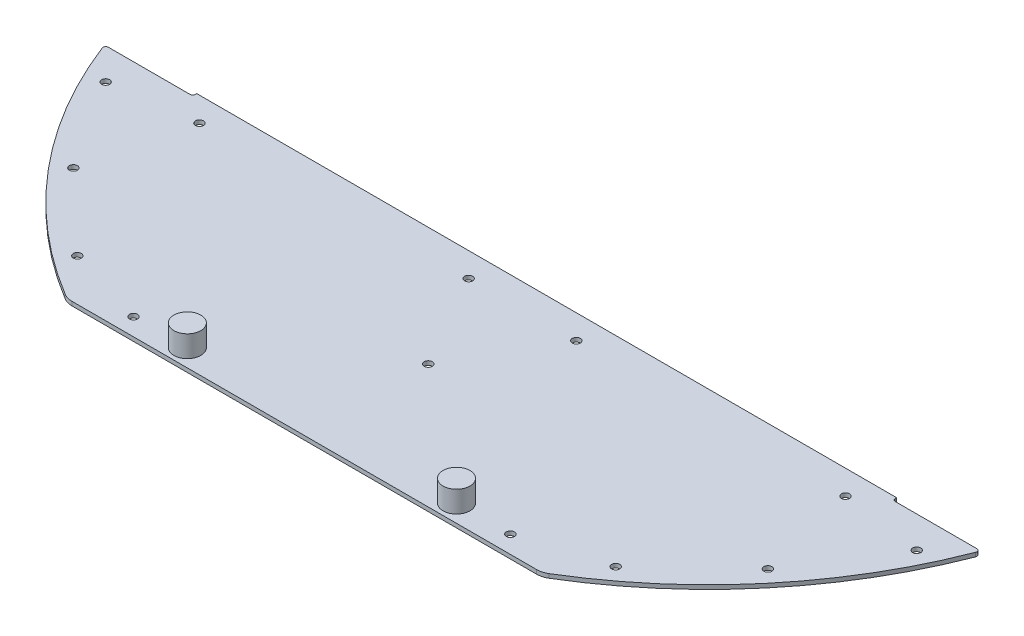
from build123d import *

# Parameters (mm, degrees)
ESQUISSE1_R             = 1.5
BOSS_EXTRU_1_DEPTH      = 1.5
CONG_1_R                = 7
CONG_2_R                = 1
ESQUISSE2_R             = 1.5
ENL_V_MAT_EXTRU_1_DEPTH = 222.017264865
ESQUISSE3_R             = 5
BOSS_EXTRU_2_DEPTH      = 8
BOSS_EXTRU_2_2_DEPTH    = 8


with BuildPart() as part:
    # Esquisse1 → Boss.-Extru.1 (new body)
    with BuildSketch(Plane(origin=(0, 0, 0), x_dir=(1, 0, 0), z_dir=(0, 1, 0))):
        with BuildLine():
            Line((-130, -60), (130, -60))
            Line((130, -60), (130, -61.5))
            Line((130, -61.5), (162.769008107, -61.5))
            ThreePointArc((162.769008107, -61.5), (133.049307719, -112.133321165), (88.18163074, -150))
            Line((88.18163074, -150), (-88.18163074, -150))
            ThreePointArc((-88.18163074, -150), (-133.049307719, -112.133321165), (-162.769008107, -61.5))
            Line((-162.769008107, -61.5), (-130, -61.5))
            Line((-130, -61.5), (-130, -60))
        make_face()
        with Locations((-120, -69)):
            Circle(ESQUISSE1_R, mode=Mode.SUBTRACT)
        with Locations((-20, -69)):
            Circle(ESQUISSE1_R, mode=Mode.SUBTRACT)
        with Locations((20, -69)):
            Circle(ESQUISSE1_R, mode=Mode.SUBTRACT)
        with Locations((120, -69)):
            Circle(ESQUISSE1_R, mode=Mode.SUBTRACT)
        with Locations((0, -104)):
            Circle(ESQUISSE1_R, mode=Mode.SUBTRACT)
    extrude(amount=BOSS_EXTRU_1_DEPTH)

    # Congé1
    cong_1_edges = [part.edges().sort_by_distance(p)[0] for p in [
        (88.18163074, 0.75, 150),
        (-88.18163074, 0.75, 150),
    ]]
    fillet(cong_1_edges, radius=CONG_1_R)

    # Congé2
    cong_2_edges = [part.edges().sort_by_distance(p)[0] for p in [
        (-130, 0.75, 61.5),
        (130, 0.75, 61.5),
        (162.769008107, 0.75, 61.5),
        (-162.769008107, 0.75, 61.5),
    ]]
    fillet(cong_2_edges, radius=CONG_2_R)

    # Esquisse2 → Enlèv. mat.-Extru.1 (cut, through all)
    with BuildSketch(Plane(origin=(0, 1.5, 0), x_dir=(1, 0, 0), z_dir=(0, 1, 0))):
        with Locations((-150.659322244, -73.198487832)):
            Circle(ESQUISSE2_R)
        with Locations((-129.008220311, -106.832247435)):
            Circle(ESQUISSE2_R)
        with Locations((-100, -134.373546504)):
            Circle(ESQUISSE2_R)
        with Locations((-70, -143.5)):
            Circle(ESQUISSE2_R)
        with Locations((-50, -143.5)):
            Circle(ESQUISSE2_R)
        with Locations((150.659322244, -73.198487832)):
            Circle(ESQUISSE2_R)
        with Locations((129.008220311, -106.832247435)):
            Circle(ESQUISSE2_R)
        with Locations((100, -134.373546504)):
            Circle(ESQUISSE2_R)
        with Locations((70, -143.5)):
            Circle(ESQUISSE2_R)
        with Locations((50, -143.5)):
            Circle(ESQUISSE2_R)
    extrude(amount=-ENL_V_MAT_EXTRU_1_DEPTH, mode=Mode.SUBTRACT)


with BuildPart() as body_2:
    # Esquisse3 → Boss.-Extru.2 (new body)
    with BuildSketch(Plane(origin=(0, 1.5, 0), x_dir=(1, 0, 0), z_dir=(0, 1, 0))):
        with Locations((-50, -143.5)):
            Circle(ESQUISSE3_R)
    extrude(amount=BOSS_EXTRU_2_DEPTH)


with BuildPart() as body_3:
    # Esquisse3 → Boss.-Extru.2 2 (new body)
    with BuildSketch(Plane(origin=(0, 1.5, 0), x_dir=(1, 0, 0), z_dir=(0, 1, 0))):
        with Locations((50, -143.5)):
            Circle(ESQUISSE3_R)
    extrude(amount=BOSS_EXTRU_2_2_DEPTH)


solid = Compound([part.part, body_2.part, body_3.part])
